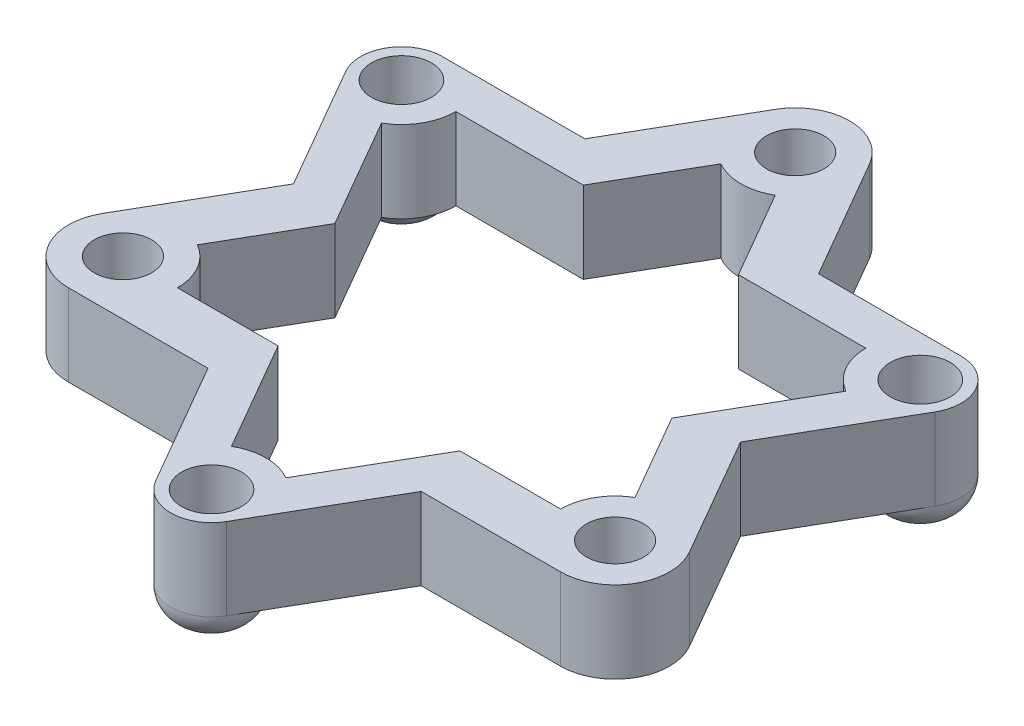
from build123d import *

# Parameters (mm, degrees)
SKETCH1_R           = 1.054
BOSS_EXTRUDE1_DEPTH = 3
SKETCH3_R           = 1.1
BOSS_EXTRUDE2_DEPTH = 3
CUT_EXTRUDE1_DEPTH  = 23.736281859
SKETCH4_R           = 1.5
BOSS_EXTRUDE3_DEPTH = 1
FILLET1_R           = 1


with BuildPart() as part:
    # Sketch1 → Boss-Extrude1 (new body)
    with BuildSketch(Plane(origin=(0, 0, 0), x_dir=(1, 0, 0), z_dir=(0, 1, 0))):
        with BuildLine():
            Line((0, 0), (9.035898385, 0))
            ThreePointArc((9.035898385, 0), (10.767949192, 1), (10.767949192, 3))
            Line((10.767949192, 3), (1.732050808, 18.650635095))
            ThreePointArc((1.732050808, 18.650635095), (0, 19.650635095), (-1.732050808, 18.650635095))
            Line((-1.732050808, 18.650635095), (-10.767949192, 3))
            ThreePointArc((-10.767949192, 3), (-10.767949192, 1), (-9.035898385, 0))
            Line((-9.035898385, 0), (0, 0))
        make_face()
        with Locations(Location((0, 17.650635095, 0), (0, 0, 270))):
            Circle(SKETCH1_R, mode=Mode.SUBTRACT)
        with Locations(Location((-9.035898385, 2, 0), (0, 0, 270))):
            Circle(SKETCH1_R, mode=Mode.SUBTRACT)
        with Locations(Location((9.035898385, 2, 0), (0, 0, 270))):
            Circle(SKETCH1_R, mode=Mode.SUBTRACT)
    extrude(amount=BOSS_EXTRUDE1_DEPTH)

    # Sketch3 → Boss-Extrude2 (add)
    with BuildSketch(Plane(origin=(0, 3, 0), x_dir=(1, 0, 0), z_dir=(0, 1, 0))):
        with BuildLine():
            Line((-9.526279442, 14.216878365), (9.526279442, 14.216878365))
            ThreePointArc((9.526279442, 14.216878365), (10.825317547, 13.466878365), (10.825317547, 11.966878365))
            Line((10.825317547, 11.966878365), (1.299038106, -4.533121635))
            ThreePointArc((1.299038106, -4.533121635), (0, -5.283121635), (-1.299038106, -4.533121635))
            Line((-1.299038106, -4.533121635), (-10.825317547, 11.966878365))
            ThreePointArc((-10.825317547, 11.966878365), (-10.825317547, 13.466878365), (-9.526279442, 14.216878365))
        make_face()
        with Locations(Location((0, -3.783121635, 0), (0, 0, 270))):
            Circle(SKETCH3_R, mode=Mode.SUBTRACT)
        with Locations(Location((-9.526279442, 12.716878365, 0), (0, 0, 270))):
            Circle(SKETCH3_R, mode=Mode.SUBTRACT)
        with Locations(Location((9.526279442, 12.716878365, 0), (0, 0, 270))):
            Circle(SKETCH3_R, mode=Mode.SUBTRACT)
    extrude(amount=-BOSS_EXTRUDE2_DEPTH)

    # Sketch2 → Cut-Extrude1 (cut, through all)
    with BuildSketch(Plane(origin=(0, 3, 0), x_dir=(1, 0, 0), z_dir=(0, 1, 0))):
        with BuildLine():
            Line((-1, 15.918584287), (-2.848505776, 12.716878365))
            Line((-2.848505776, 12.716878365), (-7.526279442, 12.716878365))
            ThreePointArc((-7.526279442, 12.716878365), (-7.794228634, 11.716878365), (-8.526279442, 10.984827557))
            Line((-8.526279442, 10.984827557), (-6.187392609, 6.93375673))
            Line((-6.187392609, 6.93375673), (-8.035898385, 3.732050808))
            ThreePointArc((-8.035898385, 3.732050808), (-7.303847577, 3), (-7.035898385, 2))
            Line((-7.035898385, 2), (-3.338886833, 2))
            Line((-3.338886833, 2), (-1, -2.051070828))
            ThreePointArc((-1, -2.051070828), (0, -1.783121635), (1, -2.051070828))
            Line((1, -2.051070828), (3.338886833, 2))
            Line((3.338886833, 2), (7.035898385, 2))
            ThreePointArc((7.035898385, 2), (7.303847577, 3), (8.035898385, 3.732050808))
            Line((8.035898385, 3.732050808), (6.187392609, 6.93375673))
            Line((6.187392609, 6.93375673), (8.526279442, 10.984827557))
            ThreePointArc((8.526279442, 10.984827557), (7.794228634, 11.716878365), (7.526279442, 12.716878365))
            Line((7.526279442, 12.716878365), (2.848505776, 12.716878365))
            Line((2.848505776, 12.716878365), (1, 15.918584287))
            ThreePointArc((1, 15.918584287), (0, 15.650635095), (-1, 15.918584287))
        make_face()
    extrude(amount=-CUT_EXTRUDE1_DEPTH, mode=Mode.SUBTRACT)

    # Sketch4 → Boss-Extrude3 (add)
    with BuildSketch(Plane.XZ):
        with Locations(Location((0, 3.783121635, 0), (0, 0, 30))):
            Circle(SKETCH4_R)
        with Locations(Location((9.526279442, -12.716878365, 0), (0, 0, 270))):
            Circle(SKETCH4_R)
        with Locations(Location((-9.526279442, -12.716878365, 0), (0, 0, 270))):
            Circle(SKETCH4_R)
    extrude(amount=BOSS_EXTRUDE3_DEPTH)

    # Fillet1
    fillet1_edges = [part.edges().sort_by_distance(p)[0] for p in [
        (-1.299038106, -1, 3.033121635),
        (9.526279442, -1, -11.216878365),
        (-9.526279442, -1, -11.216878365),
    ]]
    fillet(fillet1_edges, radius=FILLET1_R - 0.0001)  # a hair under: the kernel refuses the full size


solid = part.part
